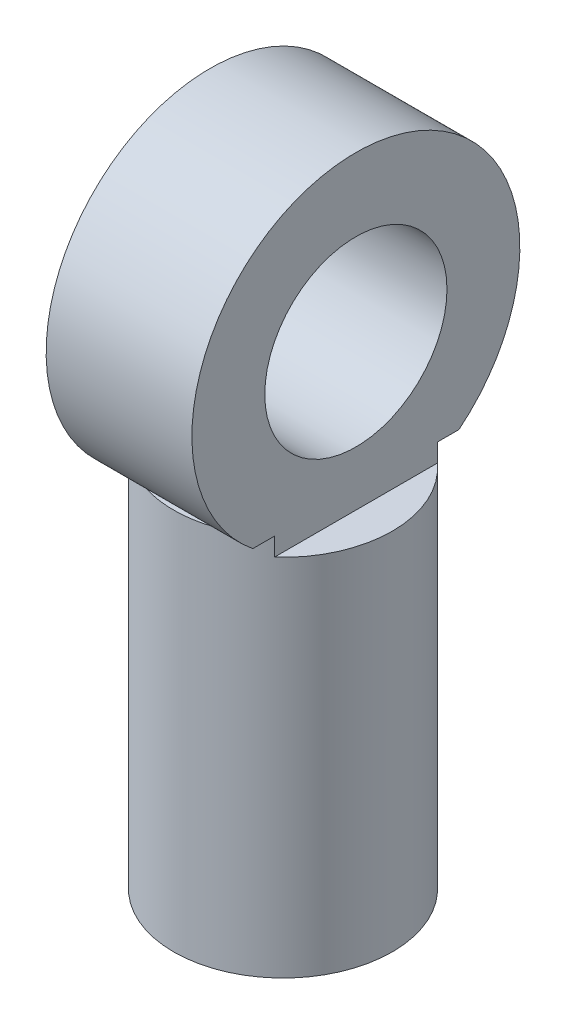
from build123d import *

# Parameters (mm, degrees)
SKETCH1_R                 = 3
CRANK_BODY_DEPTH          = 10
SKETCH2_R                 = 1.55
DOWEL_SHAFT_DEPTH         = 9
PIN_SHAFT_BODY_DEPTH      = 2
PIN_SHAFT_BODY_DEPTH_BACK = 2
SKETCH4_R                 = 2.5
PIN_SHAFT_DEPTH           = 20.685019685
SKETCH1_2_OUTSIDE_W       = 12.286
SKETCH1_2_OUTSIDE_H       = 15.286
SKETCH1_2_OUTSIDE_R       = 3
SMOOTHING_CUTS_DEPTH      = 10.5


with BuildPart() as part:
    # Sketch1 → crank_body (new body)
    with BuildSketch(Plane(origin=(0, 0, 0), x_dir=(1, 0, 0), z_dir=(0, 1, 0))):
        Circle(SKETCH1_R)
    extrude(amount=CRANK_BODY_DEPTH)

    # Sketch2 → dowel_shaft (cut)
    with BuildSketch(Plane.XZ):
        Circle(SKETCH2_R)
    extrude(amount=-DOWEL_SHAFT_DEPTH, mode=Mode.SUBTRACT)

    # Sketch3 → pin_shaft_body (add, two sides: drawn at the far end of the back side and taken through both)
    with BuildSketch(Plane(origin=(0, 0, 0), x_dir=(0, 0, -1), z_dir=(1, 0, 0)).offset(-PIN_SHAFT_BODY_DEPTH_BACK)):
        with BuildLine():
            Line((-3, 10.5), (-3, 10))
            Line((-3, 10), (3, 10))
            Line((3, 10), (3, 10.5))
            Line((3, 10.5), (2.828427125, 10.5))
            ThreePointArc((2.828427125, 10.5), (0, 18.5), (-2.828427125, 10.5))
            Line((-2.828427125, 10.5), (-3, 10.5))
        make_face()
    extrude(amount=PIN_SHAFT_BODY_DEPTH + PIN_SHAFT_BODY_DEPTH_BACK)

    # Sketch4 → pin_shaft (cut, through all)
    with BuildSketch(Plane(origin=(2, 0, 0), x_dir=(0, 0, -1), z_dir=(1, 0, 0))):
        with Locations((0, 14)):
            Circle(SKETCH4_R)
    extrude(amount=-PIN_SHAFT_DEPTH, mode=Mode.SUBTRACT)

    # Sketch1<2> outside → smoothing_cuts (cut)
    with BuildSketch(Plane(origin=(0, 0, 0), x_dir=(1, 0, 0), z_dir=(0, 1, 0))):
        Rectangle(SKETCH1_2_OUTSIDE_W, SKETCH1_2_OUTSIDE_H)
        Circle(SKETCH1_2_OUTSIDE_R, mode=Mode.SUBTRACT)
    extrude(amount=SMOOTHING_CUTS_DEPTH, mode=Mode.SUBTRACT)


solid = part.part
